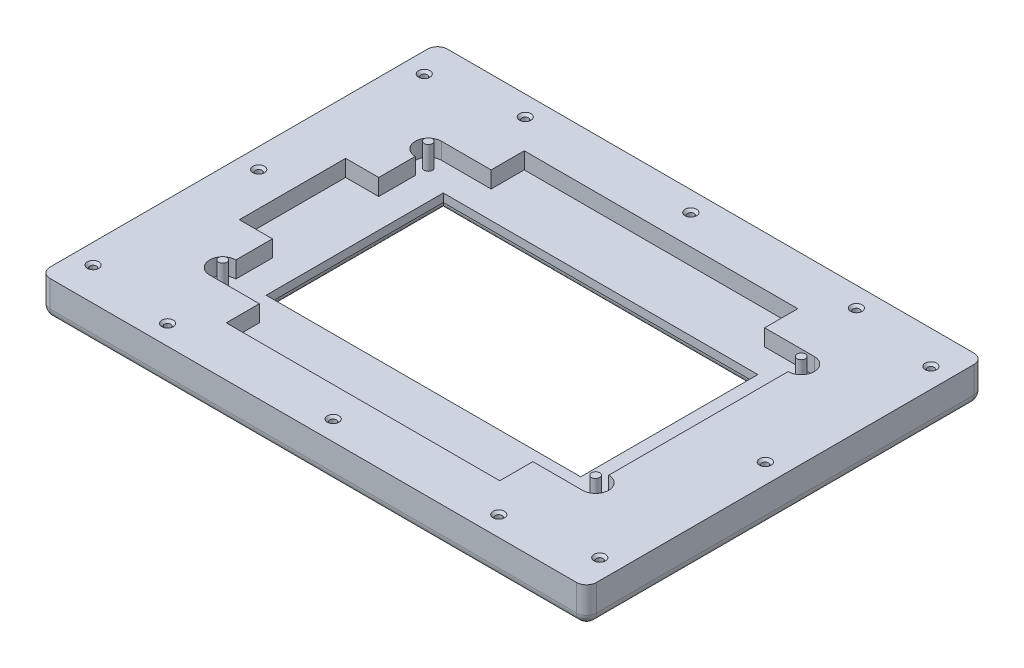
from build123d import *

# Parameters (mm, degrees)
SKETCH1_W                      = 165
SKETCH1_H                      = 120
BOSS_EXTRUDE1_DEPTH            = 6
SKETCH3_W                      = 165
SKETCH3_H                      = 120
SKETCH3_W_2                    = 155
SKETCH3_H_2                    = 110
BOSS_EXTRUDE2_DEPTH            = 5
SKETCH4_W                      = 47.5
SKETCH4_H                      = 26.75
ACRYLIC_CUTOUT_3MM_DEPTH       = 205.318379007
ACRYLIC_LIP_DEPTH              = 3.5
PEGS_DEPTH                     = 7
SKETCH5_4_W                    = 155
SKETCH5_4_H                    = 110
BOSS_EXTRUDE4_DEPTH            = 5
FILLET1_R                      = 3
FILLET2_R                      = 1
FILLET3_R                      = 3
FILLET4_R                      = 3
FILLET5_R                      = 3
FILLET6_R                      = 3
F_2_64_TAPPED_HOLE1_AT_2_COUNT = 2
F_2_64_TAPPED_HOLE1_AT_2_PITCH = 50
F_2_64_TAPPED_HOLE1_AT_3_COUNT = 2
F_2_64_TAPPED_HOLE1_AT_3_PITCH = 60.151891076
F_2_64_TAPPED_HOLE1_AT_4_COUNT = 2
F_2_64_TAPPED_HOLE1_AT_4_PITCH = 93.63893421


with BuildPart() as part:
    # Sketch1 → Boss-Extrude1 (new body)
    with BuildSketch(Plane(origin=(0, 0, 0), x_dir=(1, 0, 0), z_dir=(0, 1, 0))):
        with Locations((82.5, 60)):
            Rectangle(SKETCH1_W, SKETCH1_H)
    extrude(amount=BOSS_EXTRUDE1_DEPTH)

    # Sketch3 → Boss-Extrude2 (add)
    with BuildSketch(Plane(origin=(0, 6, 0), x_dir=(1, 0, 0), z_dir=(0, 1, 0))):
        with Locations((82.5, 60)):
            Rectangle(SKETCH3_W, SKETCH3_H)
        with Locations((82.5, 60)):
            Rectangle(SKETCH3_W_2, SKETCH3_H_2, mode=Mode.SUBTRACT)
    extrude(amount=BOSS_EXTRUDE2_DEPTH)

    # Sketch4 → Acrylic Cutout_3mm (cut, through all)
    with BuildSketch(Plane.XZ):
        with Locations((58.75, -46.625)):
            Rectangle(SKETCH4_W, SKETCH4_H)
        with Locations((58.75, -73.375)):
            Rectangle(SKETCH4_W, SKETCH4_H)
        with Locations((106.25, -73.375)):
            Rectangle(SKETCH4_W, SKETCH4_H)
        with Locations((106.25, -46.625)):
            Rectangle(SKETCH4_W, SKETCH4_H)
    extrude(amount=-ACRYLIC_CUTOUT_3MM_DEPTH, mode=Mode.SUBTRACT)

    # Sketch4<4> → Acrylic Lip (cut)
    with BuildSketch(Plane.XZ):
        Polygon((82.5, -33.25), (82.5, -31.25), (33, -31.25), (33, -60), (35, -60), (35, -33.25), align=None)
        Polygon((35, -60), (33, -60), (33, -88.75), (82.5, -88.75), (82.5, -86.75), (35, -86.75), align=None)
        Polygon((132, -88.75), (132, -60), (130, -60), (130, -86.75), (82.5, -86.75), (82.5, -88.75), align=None)
        Polygon((132, -31.25), (82.5, -31.25), (82.5, -33.25), (130, -33.25), (130, -60), (132, -60), align=None)
    extrude(amount=-ACRYLIC_LIP_DEPTH, mode=Mode.SUBTRACT)

    # Sketch5 → Pegs (add)
    with BuildSketch(Plane(origin=(0, 6, 0), x_dir=(1, 0, 0), z_dir=(0, 1, 0))):
        with BuildLine():
            ThreePointArc((26.2, 89.8), (27.083883476, 90.166116524), (27.45, 91.05))
            Line((27.45, 91.05), (26.2, 91.05))
            Line((26.2, 91.05), (26.2, 89.8))
        make_face()
        with BuildLine():
            Line((26.2, 91.05), (27.45, 91.05))
            ThreePointArc((27.45, 91.05), (25.316116524, 91.933883476), (26.2, 89.8))
            Line((26.2, 89.8), (26.2, 91.05))
        make_face()
        with BuildLine():
            ThreePointArc((26.2, 30.2), (25.316116524, 28.066116524), (27.45, 28.95))
            Line((27.45, 28.95), (26.2, 28.95))
            Line((26.2, 28.95), (26.2, 30.2))
        make_face()
        with BuildLine():
            Line((26.2, 28.95), (27.45, 28.95))
            ThreePointArc((27.45, 28.95), (27.083883476, 29.833883476), (26.2, 30.2))
            Line((26.2, 30.2), (26.2, 28.95))
        make_face()
        with BuildLine():
            ThreePointArc((140.05, 28.95), (139.683883476, 29.833883476), (138.8, 30.2))
            Line((138.8, 30.2), (138.8, 28.95))
            Line((138.8, 28.95), (137.55, 28.95))
            ThreePointArc((137.55, 28.95), (138.8, 27.7), (140.05, 28.95))
        make_face()
        with BuildLine():
            Line((138.8, 28.95), (138.8, 30.2))
            ThreePointArc((138.8, 30.2), (137.916116524, 29.833883476), (137.55, 28.95))
            Line((137.55, 28.95), (138.8, 28.95))
        make_face()
        with BuildLine():
            ThreePointArc((140.05, 91.05), (138.8, 92.3), (137.55, 91.05))
            Line((137.55, 91.05), (138.8, 91.05))
            Line((138.8, 91.05), (138.8, 89.8))
            ThreePointArc((138.8, 89.8), (139.683883476, 90.166116524), (140.05, 91.05))
        make_face()
        with BuildLine():
            Line((138.8, 91.05), (137.55, 91.05))
            ThreePointArc((137.55, 91.05), (137.916116524, 90.166116524), (138.8, 89.8))
            Line((138.8, 89.8), (138.8, 91.05))
        make_face()
    extrude(amount=PEGS_DEPTH)

    # Sketch5<4> → Boss-Extrude4 (add)
    with BuildSketch(Plane(origin=(0, 6, 0), x_dir=(1, 0, 0), z_dir=(0, 1, 0))):
        with Locations((82.5, 60)):
            Rectangle(SKETCH5_4_W, SKETCH5_4_H)
        with BuildLine():
            Line((41.2, 15), (41.2, 25))
            Line((41.2, 25), (26.2, 25))
            ThreePointArc((26.2, 25), (22.25, 28.95), (26.2, 32.9))
            Line((26.2, 32.9), (26.2, 43.95))
            Line((26.2, 43.95), (16.2, 43.95))
            Line((16.2, 43.95), (16.2, 76.05))
            Line((16.2, 76.05), (26.2, 76.05))
            Line((26.2, 76.05), (26.2, 87.1))
            ThreePointArc((26.2, 87.1), (22.25, 91.05), (26.2, 95))
            Line((26.2, 95), (41.2, 95))
            Line((41.2, 95), (41.2, 105))
            Line((41.2, 105), (123.8, 105))
            Line((123.8, 105), (123.8, 95))
            Line((123.8, 95), (138.8, 95))
            ThreePointArc((138.8, 95), (142.75, 91.05), (138.8, 87.1))
            Line((138.8, 87.1), (138.8, 32.9))
            ThreePointArc((138.8, 32.9), (142.75, 28.95), (138.8, 25))
            Line((138.8, 25), (123.8, 25))
            Line((123.8, 25), (123.8, 15))
            Line((123.8, 15), (41.2, 15))
        make_face(mode=Mode.SUBTRACT)
    extrude(amount=BOSS_EXTRUDE4_DEPTH)

    # Fillet1
    fillet1_edges = [part.edges().sort_by_distance(p)[0] for p in [
        (82.5, 0, -120),
        (165, 0, -60),
        (82.5, 0, 0),
        (0, 0, -60),
    ]]
    fillet(fillet1_edges, radius=FILLET1_R)

    # Fillet2
    fillet2_edges = [part.edges().sort_by_distance(p)[0] for p in [
        (33, 0, -60),
        (82.5, 0, -31.25),
        (82.5, 0, -88.75),
        (132, 0, -60),
    ]]
    fillet(fillet2_edges, radius=FILLET2_R)

    # Fillet3
    # the kernel refuses this fillet: 3 mm, written as the material it takes off along each edge
    with BuildSketch(Plane(origin=(3, 3, -117), x_dir=(-1, 0, 0), z_dir=(0, 0, -1))) as fillet3_piece_1_section:
        Polygon((0, 0), (FILLET3_R, 0), (FILLET3_R, -FILLET3_R), (0, -FILLET3_R), align=None)
    fillet3_piece_1 = extrude(amount=FILLET3_R, mode=Mode.PRIVATE)
    fillet3_piece_1 = fillet3_piece_1 - Plane(origin=(3, 3, -117), x_dir=(0.7071067811865475, 0.7071067811865475, 0), z_dir=(0, 0, -1)) * Sphere(FILLET3_R, mode=Mode.PRIVATE)
    add(fillet3_piece_1, mode=Mode.SUBTRACT)
    with BuildSketch(Plane(origin=(0, 18.5, -120), x_dir=(1, 0, 0), z_dir=(0, -1, 0))) as fillet3_piece_2:
        with BuildLine():
            CenterArc((FILLET3_R, FILLET3_R), FILLET3_R, 180, 90)
            Line((0, FILLET3_R), (0, 0))
            Line((0, 0), (FILLET3_R, 0))
        make_face()
    extrude(amount=15.5, mode=Mode.SUBTRACT)

    # Fillet4
    # the kernel refuses this fillet: 3 mm, written as the material it takes off along each edge
    with BuildSketch(Plane(origin=(162, 3, -117), x_dir=(1, 0, 0), z_dir=(0, 0, -1))) as fillet4_piece_1_section:
        Polygon((0, 0), (FILLET4_R, 0), (FILLET4_R, FILLET4_R), (0, FILLET4_R), align=None)
    fillet4_piece_1 = extrude(amount=FILLET4_R, mode=Mode.PRIVATE)
    fillet4_piece_1 = fillet4_piece_1 - Plane(origin=(162, 3, -117), x_dir=(-0.7071067811865475, 0.7071067811865475, 0), z_dir=(0, 0, -1)) * Sphere(FILLET4_R, mode=Mode.PRIVATE)
    add(fillet4_piece_1, mode=Mode.SUBTRACT)
    with BuildSketch(Plane(origin=(165, 3, -120), x_dir=(-1, 0, 0), z_dir=(0, 1, 0))) as fillet4_piece_2:
        with BuildLine():
            CenterArc((FILLET4_R, FILLET4_R), FILLET4_R, 180, 90)
            Line((0, FILLET4_R), (0, 0))
            Line((0, 0), (FILLET4_R, 0))
        make_face()
    extrude(amount=15.5, mode=Mode.SUBTRACT)

    # Fillet5
    # the kernel refuses this fillet: 3 mm, written as the material it takes off along each edge
    with BuildSketch(Plane(origin=(162, 3, -3), x_dir=(0, 0, 1), z_dir=(1, 0, 0))) as fillet5_piece_1_section:
        Polygon((0, 0), (FILLET5_R, 0), (FILLET5_R, FILLET5_R), (0, FILLET5_R), align=None)
    fillet5_piece_1 = extrude(amount=FILLET5_R, mode=Mode.PRIVATE)
    fillet5_piece_1 = fillet5_piece_1 - Plane(origin=(162, 3, -3), x_dir=(0, 0.7071067811865475, -0.7071067811865475), z_dir=(1, 0, 0)) * Sphere(FILLET5_R, mode=Mode.PRIVATE)
    add(fillet5_piece_1, mode=Mode.SUBTRACT)
    with BuildSketch(Plane(origin=(165, 3, 0), x_dir=(0, 0, -1), z_dir=(0, 1, 0))) as fillet5_piece_2:
        with BuildLine():
            CenterArc((FILLET5_R, FILLET5_R), FILLET5_R, 180, 90)
            Line((0, FILLET5_R), (0, 0))
            Line((0, 0), (FILLET5_R, 0))
        make_face()
    extrude(amount=15.5, mode=Mode.SUBTRACT)

    # Fillet6
    # the kernel refuses this fillet: 3 mm, written as the material it takes off along each edge
    with BuildSketch(Plane(origin=(3, 3, -3), x_dir=(0, 0, 1), z_dir=(-1, 0, 0))) as fillet6_piece_1_section:
        Polygon((0, 0), (FILLET6_R, 0), (FILLET6_R, -FILLET6_R), (0, -FILLET6_R), align=None)
    fillet6_piece_1 = extrude(amount=FILLET6_R, mode=Mode.PRIVATE)
    fillet6_piece_1 = fillet6_piece_1 - Plane(origin=(3, 3, -3), x_dir=(0, 0.7071067811865475, -0.7071067811865475), z_dir=(-1, 0, 0)) * Sphere(FILLET6_R, mode=Mode.PRIVATE)
    add(fillet6_piece_1, mode=Mode.SUBTRACT)
    with BuildSketch(Plane(origin=(0, 18.5, 0), x_dir=(0, 0, -1), z_dir=(0, -1, 0))) as fillet6_piece_2:
        with BuildLine():
            CenterArc((FILLET6_R, FILLET6_R), FILLET6_R, 180, 90)
            Line((0, FILLET6_R), (0, 0))
            Line((0, 0), (FILLET6_R, 0))
        make_face()
    extrude(amount=15.5, mode=Mode.SUBTRACT)

    # Sketch8 → #2-64 Tapped Hole1 (revolve, cut)
    with BuildSketch(Plane(origin=(6, 11, -60), x_dir=(0, 0, 1), z_dir=(1, 0, 0))):
        Polygon((0, 0), (0, 5.600860638), (1.000000032, 5), (1.000000032, 0.727199968), (1.7272, 0), align=None)
    f_2_64_tapped_hole1 = revolve(axis=Axis((6, 17.35, -60), (0, -1, 0)), mode=Mode.SUBTRACT)

    # #2-64 Tapped Hole1 at 2: #2-64 Tapped Hole1 ×2
    with Locations(*[(0, 0, -i * F_2_64_TAPPED_HOLE1_AT_2_PITCH) for i in range(1, F_2_64_TAPPED_HOLE1_AT_2_COUNT)]):
        add(f_2_64_tapped_hole1, mode=Mode.SUBTRACT)

    # #2-64 Tapped Hole1 at 3: #2-64 Tapped Hole1 ×2
    with Locations(*[Vector(0.4405514028908514, 0, -0.8977273870228661) * (i * F_2_64_TAPPED_HOLE1_AT_3_PITCH) for i in range(1, F_2_64_TAPPED_HOLE1_AT_3_COUNT)]):
        add(f_2_64_tapped_hole1, mode=Mode.SUBTRACT)

    # #2-64 Tapped Hole1 at 4: #2-64 Tapped Hole1 ×2
    with Locations(*[Vector(0.8169678632647619, 0, -0.5766831975986552) * (i * F_2_64_TAPPED_HOLE1_AT_4_PITCH) for i in range(1, F_2_64_TAPPED_HOLE1_AT_4_COUNT)]):
        add(f_2_64_tapped_hole1, mode=Mode.SUBTRACT)

    # Mirror1: #2-64 Tapped Hole1 across plane
    add(f_2_64_tapped_hole1.mirror(Plane(origin=(82.5, 0, 0), x_dir=(0, 0, 1), z_dir=(1, 0, 0))), mode=Mode.SUBTRACT)

    # Mirror1 copy 1 sketch → Mirror1 copy 1 (revolve, cut)
    with BuildSketch(Plane(origin=(159, 11, -110), x_dir=(0, 0, 1), z_dir=(-1, 0, 0))):
        Polygon((0, 0), (0, -5.600860638), (1.000000032, -5), (1.000000032, -0.727199968), (1.7272, 0), align=None)
    revolve(axis=Axis((159, 17.35, -110), (0, 1, 0)), mode=Mode.SUBTRACT)

    # Mirror1 copy 2 sketch → Mirror1 copy 2 (revolve, cut)
    with BuildSketch(Plane(origin=(132.5, 11, -114), x_dir=(0, 0, 1), z_dir=(-1, 0, 0))):
        Polygon((0, 0), (0, -5.600860638), (1.000000032, -5), (1.000000032, -0.727199968), (1.7272, 0), align=None)
    revolve(axis=Axis((132.5, 17.35, -114), (0, 1, 0)), mode=Mode.SUBTRACT)

    # Mirror1 copy 3 sketch → Mirror1 copy 3 (revolve, cut)
    with BuildSketch(Plane(origin=(82.5, 11, -114), x_dir=(0, 0, 1), z_dir=(-1, 0, 0))):
        Polygon((0, 0), (0, -5.600860638), (1.000000032, -5), (1.000000032, -0.727199968), (1.7272, 0), align=None)
    revolve(axis=Axis((82.5, 17.35, -114), (0, 1, 0)), mode=Mode.SUBTRACT)

    # Mirror1 at the second plane: #2-64 Tapped Hole1 across plane
    add(f_2_64_tapped_hole1.mirror(Plane.XY.offset(-60)), mode=Mode.SUBTRACT)

    # Mirror1 at the second plane copy 1 sketc → Mirror1 at the second plane copy 1 (revolve, cut)
    with BuildSketch(Plane(origin=(6, 11, -10), x_dir=(0, 0, -1), z_dir=(1, 0, 0))):
        Polygon((0, 0), (0, -5.600860638), (1.000000032, -5), (1.000000032, -0.727199968), (1.7272, 0), align=None)
    revolve(axis=Axis((6, 17.35, -10), (0, 1, 0)), mode=Mode.SUBTRACT)

    # Mirror1 at the second plane copy 2 sketc → Mirror1 at the second plane copy 2 (revolve, cut)
    with BuildSketch(Plane(origin=(32.5, 11, -6), x_dir=(0, 0, -1), z_dir=(1, 0, 0))):
        Polygon((0, 0), (0, -5.600860638), (1.000000032, -5), (1.000000032, -0.727199968), (1.7272, 0), align=None)
    revolve(axis=Axis((32.5, 17.35, -6), (0, 1, 0)), mode=Mode.SUBTRACT)

    # Mirror1 at the second plane copy 3 sketc → Mirror1 at the second plane copy 3 (revolve, cut)
    with BuildSketch(Plane(origin=(82.5, 11, -6), x_dir=(0, 0, -1), z_dir=(1, 0, 0))):
        Polygon((0, 0), (0, -5.600860638), (1.000000032, -5), (1.000000032, -0.727199968), (1.7272, 0), align=None)
    revolve(axis=Axis((82.5, 17.35, -6), (0, 1, 0)), mode=Mode.SUBTRACT)

    # Mirror1 at the second plane copy 4 sketc → Mirror1 at the second plane copy 4 (revolve, cut)
    with BuildSketch(Plane(origin=(159, 11, -60), x_dir=(0, 0, -1), z_dir=(-1, 0, 0))):
        Polygon((0, 0), (0, 5.600860638), (1.000000032, 5), (1.000000032, 0.727199968), (1.7272, 0), align=None)
    revolve(axis=Axis((159, 17.35, -60), (0, -1, 0)), mode=Mode.SUBTRACT)

    # Mirror1 at the second plane copy 5 sketc → Mirror1 at the second plane copy 5 (revolve, cut)
    with BuildSketch(Plane(origin=(159, 11, -10), x_dir=(0, 0, -1), z_dir=(-1, 0, 0))):
        Polygon((0, 0), (0, 5.600860638), (1.000000032, 5), (1.000000032, 0.727199968), (1.7272, 0), align=None)
    revolve(axis=Axis((159, 17.35, -10), (0, -1, 0)), mode=Mode.SUBTRACT)

    # Mirror1 at the second plane copy 6 sketc → Mirror1 at the second plane copy 6 (revolve, cut)
    with BuildSketch(Plane(origin=(132.5, 11, -6), x_dir=(0, 0, -1), z_dir=(-1, 0, 0))):
        Polygon((0, 0), (0, 5.600860638), (1.000000032, 5), (1.000000032, 0.727199968), (1.7272, 0), align=None)
    revolve(axis=Axis((132.5, 17.35, -6), (0, -1, 0)), mode=Mode.SUBTRACT)

    # Mirror1 at the second plane copy 7 sketc → Mirror1 at the second plane copy 7 (revolve, cut)
    with BuildSketch(Plane(origin=(82.5, 11, -6), x_dir=(0, 0, -1), z_dir=(-1, 0, 0))):
        Polygon((0, 0), (0, 5.600860638), (1.000000032, 5), (1.000000032, 0.727199968), (1.7272, 0), align=None)
    revolve(axis=Axis((82.5, 17.35, -6), (0, -1, 0)), mode=Mode.SUBTRACT)


solid = part.part
